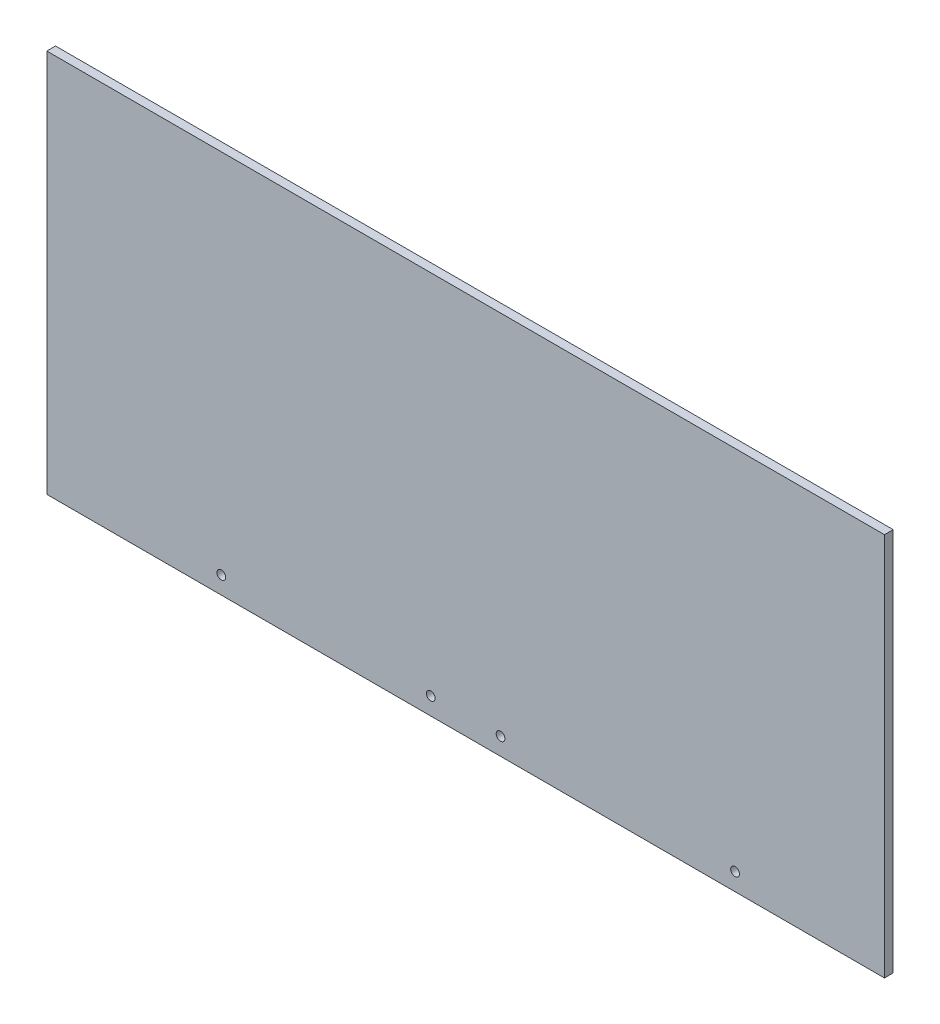
from build123d import *

# Parameters (mm, degrees)
SKETCH1_W           = 609.6
SKETCH1_H           = 279.4
SKETCH1_R           = 3.175
BOSS_EXTRUDE1_DEPTH = 6.35


with BuildPart() as part:
    # Sketch1 → Boss-Extrude1 (new body)
    with BuildSketch(Plane.XY):
        with Locations((-20.012121212, -61.832323232)):
            Rectangle(SKETCH1_W, SKETCH1_H)
        with Locations((-45.412121212, -188.832323232)):
            Circle(SKETCH1_R, mode=Mode.SUBTRACT)
        with Locations((5.387878788, -188.832323232)):
            Circle(SKETCH1_R, mode=Mode.SUBTRACT)
        with Locations((-197.812121212, -188.832323232)):
            Circle(SKETCH1_R, mode=Mode.SUBTRACT)
        with Locations((176.050478788, -188.832323232)):
            Circle(SKETCH1_R, mode=Mode.SUBTRACT)
    extrude(amount=BOSS_EXTRUDE1_DEPTH)


solid = part.part
